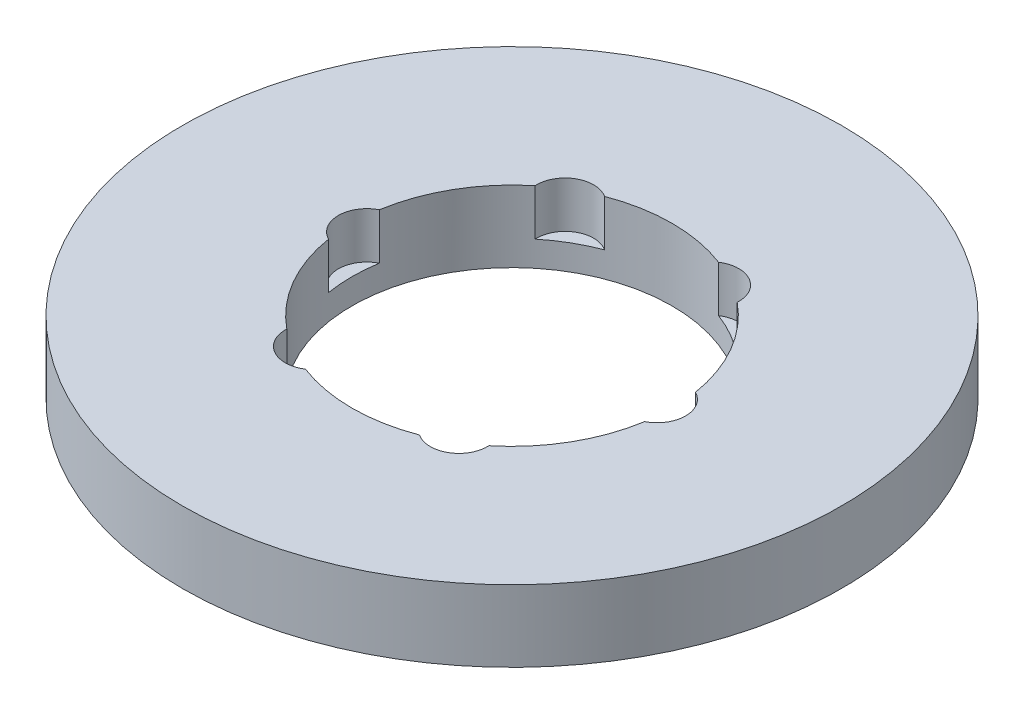
from build123d import *

# Parameters (mm, degrees)
SKETCH1_R           = 87.5
BOSS_EXTRUDE1_DEPTH = 19
SKETCH2_R           = 42.5
CUT_EXTRUDE1_DEPTH  = 126.193849689
SKETCH3_R           = 7.571035455
CUT_EXTRUDE2_DEPTH  = 12.281247551
CIRPATTERN1_COUNT   = 6


with BuildPart() as part:
    # Sketch1 → Boss-Extrude1 (new body)
    with BuildSketch(Plane(origin=(0, 0, 0), x_dir=(1, 0, 0), z_dir=(0, 1, 0))):
        Circle(SKETCH1_R)
    extrude(amount=BOSS_EXTRUDE1_DEPTH)

    # Sketch2 → Cut-Extrude1 (cut, through all)
    with BuildSketch(Plane(origin=(0, 0, 0), x_dir=(1, 0, 0), z_dir=(0, 1, 0))):
        Circle(SKETCH2_R)
    extrude(amount=CUT_EXTRUDE1_DEPTH, mode=Mode.SUBTRACT)

    # Sketch3 → Cut-Extrude2 (cut)
    with BuildSketch(Plane(origin=(0, 19, 0), x_dir=(1, 0, 0), z_dir=(0, 1, 0))):
        with Locations((-38.532263478, 0)):
            Circle(SKETCH3_R)
    cut_extrude2 = extrude(amount=-CUT_EXTRUDE2_DEPTH, mode=Mode.SUBTRACT)

    # CirPattern1: Cut-Extrude2 ×6 about axis
    cirpattern1_axis = Axis((0, 0, 0), (0, 1, 0))
    for i in range(1, CIRPATTERN1_COUNT):
        add(cut_extrude2.rotate(cirpattern1_axis, i * 360 / CIRPATTERN1_COUNT), mode=Mode.SUBTRACT)


solid = part.part
